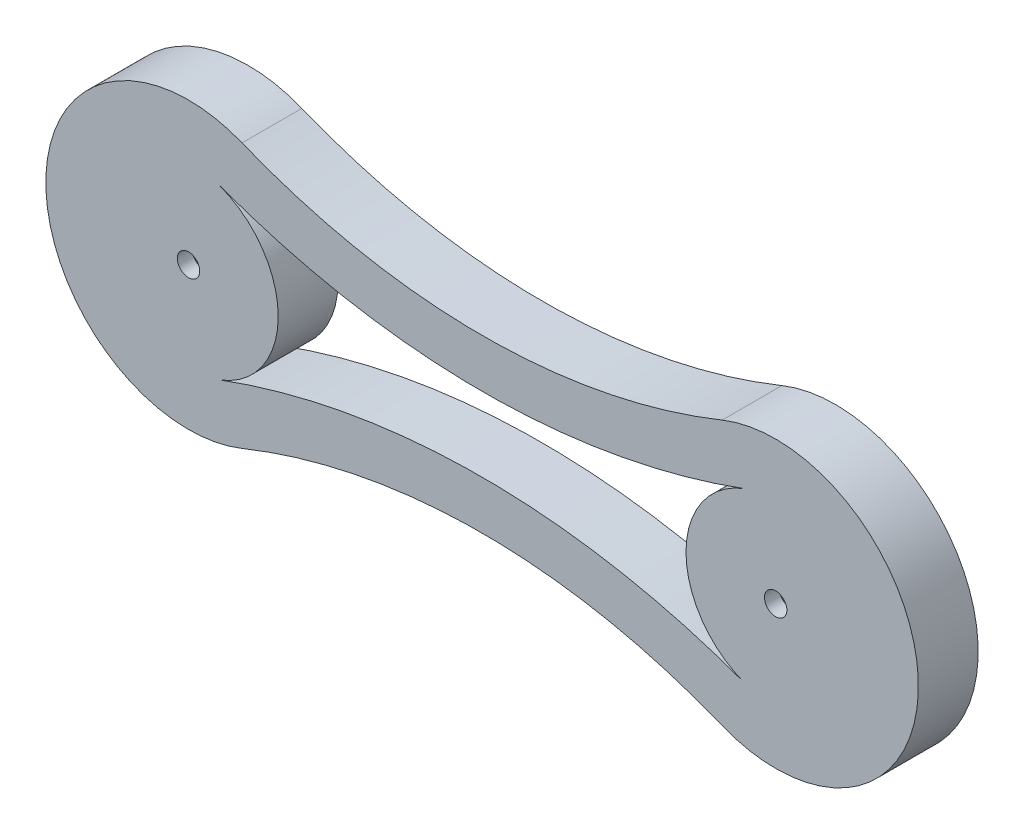
from build123d import *

# Parameters (mm, degrees)
SKIZZE1_R                           = 0.75
AUFSATZ_LINEAR_AUSTRAGEN1_DEPTH     = 4
SCHNITT_LINEAR_START                = -3
SCHNITT_LINEAR_AUSTRAGEN2_OUTLINE_R = 0.75
SCHNITT_LINEAR_AUSTRAGEN2_DEPTH     = 3
SCHNITT_LINEAR_AUSTRAGEN3_DEPTH     = 10


# Read off the part's stored shape, not the designer's step: Schnitt-Linear austragen2
with BuildPart() as part:
    # Skizze1 → Aufsatz-Linear austragen1 (new body)
    with BuildSketch(Plane.XY):
        with BuildLine():
            ThreePointArc((-16.060120321, 8.85129891), (0, 5.725515256), (16.060120321, 8.85129891))
            ThreePointArc((16.060120321, 8.85129891), (29.189527365, 0), (16.060120321, -8.85129891))
            ThreePointArc((16.060120321, -8.85129891), (0, -5.725515256), (-16.060120321, -8.85129891))
            ThreePointArc((-16.060120321, -8.85129891), (-29.189527365, 0), (-16.060120321, 8.85129891))
        make_face()
        with Locations((-19.641235471, 0)):
            Circle(SKIZZE1_R, mode=Mode.SUBTRACT)
        with Locations((19.641235471, 0)):
            Circle(SKIZZE1_R, mode=Mode.SUBTRACT)
    extrude(amount=-AUFSATZ_LINEAR_AUSTRAGEN1_DEPTH)

    # Schnitt-Linear austragen2 outline → Schnitt-Linear austragen2 (cut)
    # profile 1 of 2: a face of its own
    with BuildSketch(Plane(origin=(0, 0, -4), x_dir=(-1, 0, 0), z_dir=(0, 0, -1)).offset(SCHNITT_LINEAR_START)):
        Polygon((20.724665483, 2.159923975), (20.316960681, 2.024603637), (20.072258051, 2.377669385), (19.719192303, 2.132966755), (19.384931733, 2.402790162), (19.115108326, 2.068529592), (18.718369619, 2.23325117), (18.553648041, 1.836512464), (18.126572608, 1.88278745), (18.080297621, 1.455712017), (17.657484574, 1.379791488), (17.733405103, 0.956978441), (17.34910824, 0.765013026), (17.541073655, 0.380716163), (17.226426423, 0.088257758), (17.518884828, -0.226389475), (17.299378073, -0.595647629), (17.668636227, -0.815154384), (17.562053082, -1.231297187), (17.978195885, -1.337880332), (17.993171082, -1.76719437), (18.42248512, -1.752219173), (18.557805458, -2.159923975), (18.965510261, -2.024603637), (19.210212891, -2.377669385), (19.563278639, -2.132966755), (19.897539209, -2.402790162), (20.167362616, -2.068529592), (20.564101323, -2.23325117), (20.728822901, -1.836512464), (21.155898334, -1.88278745), (21.20217332, -1.455712017), (21.624986367, -1.379791488), (21.549065838, -0.956978441), (21.933362701, -0.765013026), (21.741397286, -0.380716163), (22.056044519, -0.088257758), (21.763586114, 0.226389475), (21.983092869, 0.595647629), (21.613834715, 0.815154384), (21.72041786, 1.231297187), (21.304275056, 1.337880332), (21.289299859, 1.76719437), (20.859985821, 1.752219173), align=None)
        with Locations((19.641235471, 0)):
            Circle(SCHNITT_LINEAR_AUSTRAGEN2_OUTLINE_R, mode=Mode.SUBTRACT)
    # profile 2 of 2: a face of its own
    with BuildSketch(Plane(origin=(0, 0, -4), x_dir=(-1, 0, 0), z_dir=(0, 0, -1)).offset(SCHNITT_LINEAR_START)):
        Polygon((-18.557805458, 2.159923975), (-18.965510261, 2.024603637), (-19.210212891, 2.377669385), (-19.563278639, 2.132966755), (-19.897539209, 2.402790162), (-20.167362616, 2.068529592), (-20.564101323, 2.23325117), (-20.728822901, 1.836512464), (-21.155898334, 1.88278745), (-21.20217332, 1.455712017), (-21.624986367, 1.379791488), (-21.549065838, 0.956978441), (-21.933362701, 0.765013026), (-21.741397286, 0.380716163), (-22.056044519, 0.088257758), (-21.763586114, -0.226389475), (-21.983092869, -0.595647629), (-21.613834715, -0.815154384), (-21.72041786, -1.231297187), (-21.304275056, -1.337880332), (-21.289299859, -1.76719437), (-20.859985821, -1.752219173), (-20.724665483, -2.159923975), (-20.316960681, -2.024603637), (-20.072258051, -2.377669385), (-19.719192303, -2.132966755), (-19.384931733, -2.402790162), (-19.115108326, -2.068529592), (-18.718369619, -2.23325117), (-18.553648041, -1.836512464), (-18.126572608, -1.88278745), (-18.080297621, -1.455712017), (-17.657484574, -1.379791488), (-17.733405103, -0.956978441), (-17.34910824, -0.765013026), (-17.541073655, -0.380716163), (-17.226426423, -0.088257758), (-17.518884828, 0.226389475), (-17.299378073, 0.595647629), (-17.668636227, 0.815154384), (-17.562053082, 1.231297187), (-17.978195885, 1.337880332), (-17.993171082, 1.76719437), (-18.42248512, 1.752219173), align=None)
        with Locations((-19.641235471, 0)):
            Circle(SCHNITT_LINEAR_AUSTRAGEN2_OUTLINE_R, mode=Mode.SUBTRACT)
    extrude(amount=SCHNITT_LINEAR_AUSTRAGEN2_DEPTH, mode=Mode.SUBTRACT)

    # Skizze4 → Schnitt-Linear austragen3 (cut)
    with BuildSketch(Plane(origin=(0, 0, -4), x_dir=(-1, 0, 0), z_dir=(0, 0, -1))):
        with BuildLine():
            ThreePointArc((-17.558911686, -5.627070966), (-13.641235471, 0), (-17.558911686, 5.627070966))
            ThreePointArc((-17.558911686, 5.627070966), (0, 2.482397681), (17.558911686, 5.627070966))
            ThreePointArc((17.558911686, 5.627070966), (13.641235471, 0), (17.558911686, -5.627070966))
            ThreePointArc((17.558911686, -5.627070966), (0, -2.482397681), (-17.558911686, -5.627070966))
        make_face()
    extrude(amount=-SCHNITT_LINEAR_AUSTRAGEN3_DEPTH, mode=Mode.SUBTRACT)


solid = part.part
